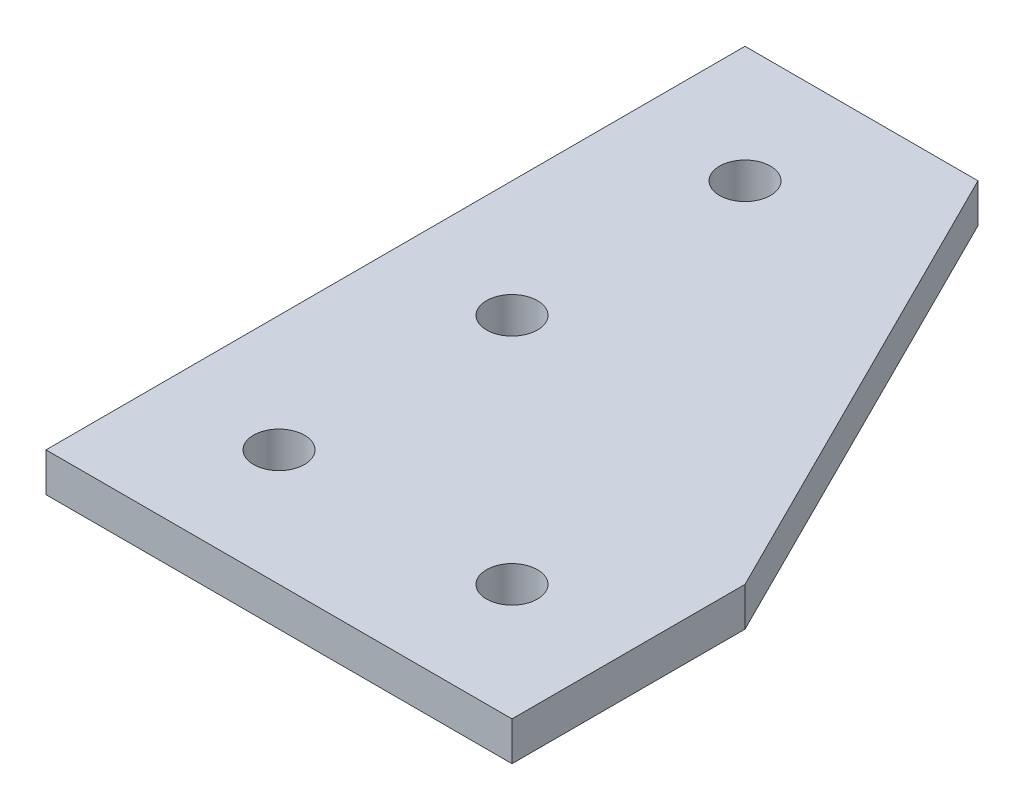
from build123d import *

# Parameters (mm, degrees)
SKETCH1_W            = 76.2
SKETCH1_H            = 6.35
BOSS_EXTRUDE1_DEPTH  = 57.15
CUT_EXTRUDE3_DEPTH   = 7.62
LPATTERN1_COUNT      = 3
LPATTERN1_PITCH      = 38.1
LPATTERN1_COUNT_DIR2 = 2
LPATTERN1_PITCH_DIR2 = 38.1


with BuildPart() as part:
    # Sketch1 → Boss-Extrude1 (new, symmetric)
    with BuildSketch(Plane.XY):
        Rectangle(SKETCH1_W, SKETCH1_H)
    extrude(amount=BOSS_EXTRUDE1_DEPTH, both=True)

    # Sketch8 → Cut-Extrude3 (cut)
    with BuildSketch(Plane(origin=(0, 3.175, 0), x_dir=(-1, 0, 0), z_dir=(0, 1, 0))):
        Polygon((0, -57.15), (-38.1, 19.05), (-38.1, -57.15), align=None)
    extrude(amount=-CUT_EXTRUDE3_DEPTH, mode=Mode.SUBTRACT)

    # Sketch9 → 21/64 (0.32813) Diameter Hole1 (revolve, cut)
    with BuildSketch(Plane(origin=(-19.05, 3.175, 38.1), x_dir=(0, 0, 1), z_dir=(1, 0, 0))):
        Polygon((0, 0), (0, 8.853937016), (4.167251, 6.35), (4.167251, 0), align=None)
    f_21_64_0_32813_diameter_hole1 = revolve(axis=Axis((-19.05, 9.525, 38.1), (0, -1, 0)), mode=Mode.SUBTRACT)

    # LPattern1: 21_64 _0.32813_ Diameter Hole1 3 × 2, 2 skipped
    with Locations(*[(j * LPATTERN1_PITCH_DIR2, 0, -i * LPATTERN1_PITCH) for i in range(LPATTERN1_COUNT) for j in range(LPATTERN1_COUNT_DIR2) if (i, j) not in ((0, 0), (1, 1), (2, 1))]):
        add(f_21_64_0_32813_diameter_hole1, mode=Mode.SUBTRACT)


solid = part.part
